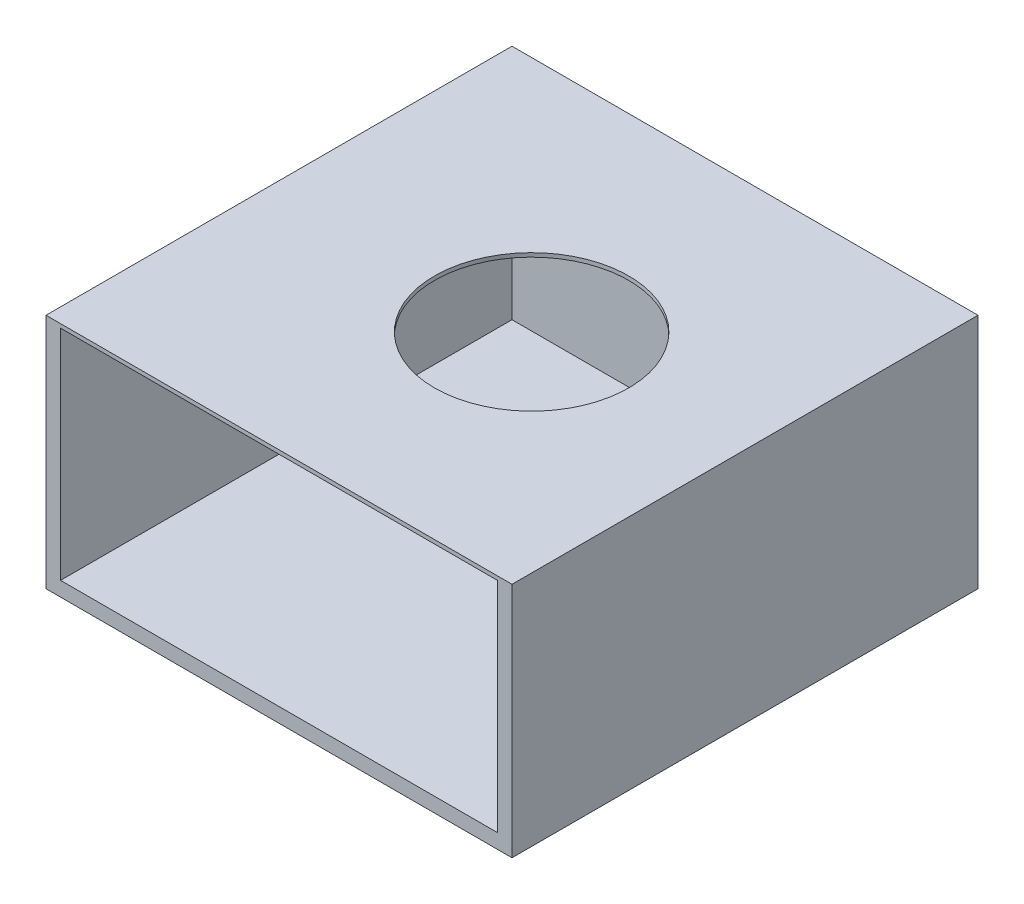
from build123d import *

# Parameters (mm, degrees)
SKETCH1_W           = 304.8
SKETCH1_H           = 152.4
BOSS_EXTRUDE1_DEPTH = 304.8
SHELL1_T            = -9.525
BOSS_EXTRUDE2_DEPTH = 2.54
SKETCH4_R           = 63.5
CUT_EXTRUDE1_DEPTH  = 7.62


with BuildPart() as part:
    # Sketch1 → Boss-Extrude1 (new body)
    with BuildSketch(Plane.XY):
        Rectangle(SKETCH1_W, SKETCH1_H)
    extrude(amount=BOSS_EXTRUDE1_DEPTH)

    # Shell1
    shell1_openings = [part.faces().sort_by_distance(p)[0] for p in [
        (0, 0, 304.8),
        (0, 76.2, 152.4),
    ]]
    offset(amount=SHELL1_T, openings=shell1_openings, kind=Kind.INTERSECTION)

    # Sketch2 → Boss-Extrude2 (add)
    with BuildSketch(Plane(origin=(0, 76.2, 0), x_dir=(1, 0, 0), z_dir=(0, 1, 0))):
        Polygon((-142.875, -304.8), (142.875, -304.8), (152.4, -304.8), (152.4, 0), (-152.4, 0), (-152.4, -304.8), align=None)
    extrude(amount=BOSS_EXTRUDE2_DEPTH)

    # Sketch4 → Cut-Extrude1 (cut)
    with BuildSketch(Plane(origin=(0, 78.74, 0), x_dir=(1, 0, 0), z_dir=(0, 1, 0))):
        with Locations((15.875, -155.428881859)):
            Circle(SKETCH4_R)
    extrude(amount=-CUT_EXTRUDE1_DEPTH, mode=Mode.SUBTRACT)


solid = part.part
